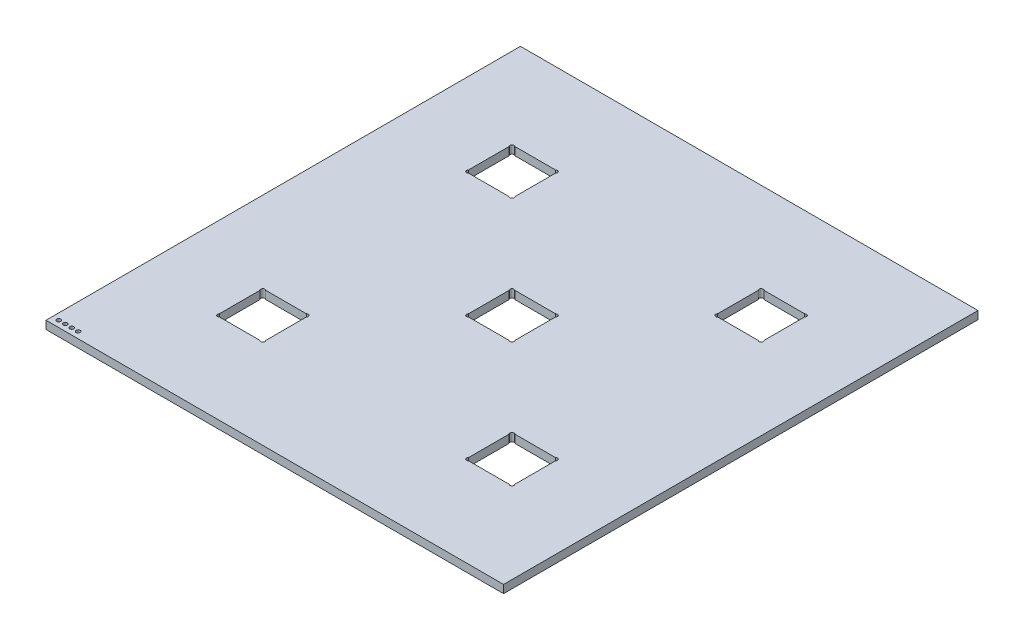
from build123d import *

# Parameters (mm, degrees)
SKETCH1_W           = 180.7718
SKETCH1_H           = 187.452
BOSS_EXTRUDE1_DEPTH = 3.175
SKETCH2_W           = 18.288
SKETCH2_H           = 18.288
CUT_EXTRUDE1_DEPTH  = 3.175
SKETCH3_R           = 0.79375
CUT_EXTRUDE2_DEPTH  = 131.246898696
SKETCH9_R           = 0.79375
CUT_EXTRUDE4_DEPTH  = 1.27
LPATTERN1_COUNT     = 4
LPATTERN1_PITCH     = 2.54


with BuildPart() as part:
    # Sketch1 → Boss-Extrude1 (new body)
    with BuildSketch(Plane(origin=(0, 0, 0), x_dir=(1, 0, 0), z_dir=(0, 1, 0))):
        Rectangle(SKETCH1_W, SKETCH1_H)
    extrude(amount=BOSS_EXTRUDE1_DEPTH)

    # Sketch2 → Cut-Extrude1 (cut)
    with BuildSketch(Plane(origin=(0, 3.175, 0), x_dir=(1, 0, 0), z_dir=(0, 1, 0))):
        Rectangle(SKETCH2_W, SKETCH2_H)
    cut_extrude1 = extrude(amount=-CUT_EXTRUDE1_DEPTH, mode=Mode.SUBTRACT)

    # Sketch3 → Cut-Extrude2 (cut, through all)
    with BuildSketch(Plane(origin=(0, 3.175, 0), x_dir=(1, 0, 0), z_dir=(0, 1, 0))):
        with Locations((8.582733992, -8.582733992)):
            Circle(SKETCH3_R)
        with Locations((-8.582733992, -8.582733992)):
            Circle(SKETCH3_R)
        with Locations((-8.582733992, 8.582733992)):
            Circle(SKETCH3_R)
        with Locations((8.582733992, 8.582733992)):
            Circle(SKETCH3_R)
    cut_extrude2 = extrude(amount=-CUT_EXTRUDE2_DEPTH, mode=Mode.SUBTRACT)

    # Sketch-Pattern1: Cut-Extrude1, Cut-Extrude2 at 4 more places
    with Locations((-49.2125, 0, 49.2125), (-49.2125, 0, -49.2125), (49.2125, 0, -49.2125), (49.2125, 0, 49.2125)):
        add(cut_extrude1, mode=Mode.SUBTRACT)
        add(cut_extrude2, mode=Mode.SUBTRACT)

    # Sketch9 → Cut-Extrude4 (cut)
    with BuildSketch(Plane(origin=(0, 3.175, 0), x_dir=(1, 0, 0), z_dir=(0, 1, 0))):
        with Locations((-87.8459, -91.186)):
            Circle(SKETCH9_R)
    cut_extrude4 = extrude(amount=-CUT_EXTRUDE4_DEPTH, mode=Mode.SUBTRACT)

    # LPattern1: Cut-Extrude4 ×4
    with Locations(*[(i * LPATTERN1_PITCH, 0, 0) for i in range(1, LPATTERN1_COUNT)]):
        add(cut_extrude4, mode=Mode.SUBTRACT)


solid = part.part
